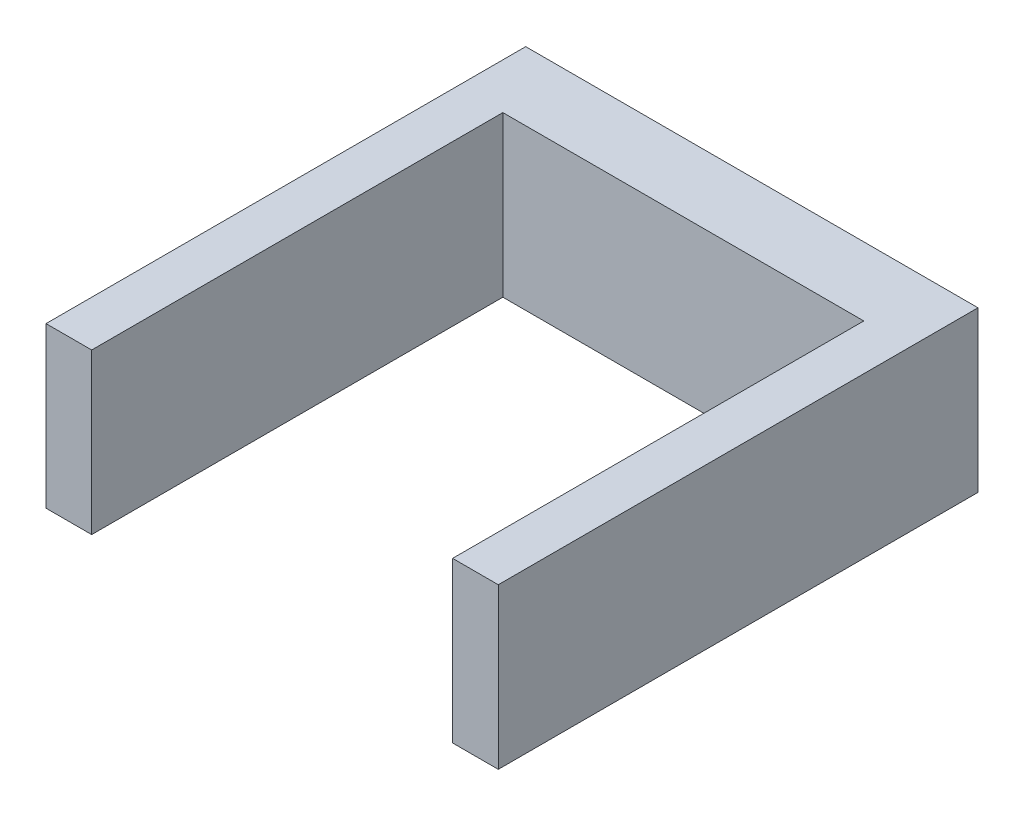
from build123d import *

# Parameters (mm, degrees)
BOSS_EXTRUDE1_DEPTH = 7


with BuildPart() as part:
    # Sketch1 → Boss-Extrude1 (new body)
    with BuildSketch(Plane(origin=(0, 0, 0), x_dir=(1, 0, 0), z_dir=(0, 1, 0))):
        Polygon((-5.773972603, 12.318493151), (-5.773972603, -8.681506849), (-3.773972603, -8.681506849), (-3.773972603, 9.318493151), (12.026027397, 9.318493151), (12.026027397, -8.681506849), (14.026027397, -8.681506849), (14.026027397, 12.318493151), align=None)
    extrude(amount=BOSS_EXTRUDE1_DEPTH)


solid = part.part
